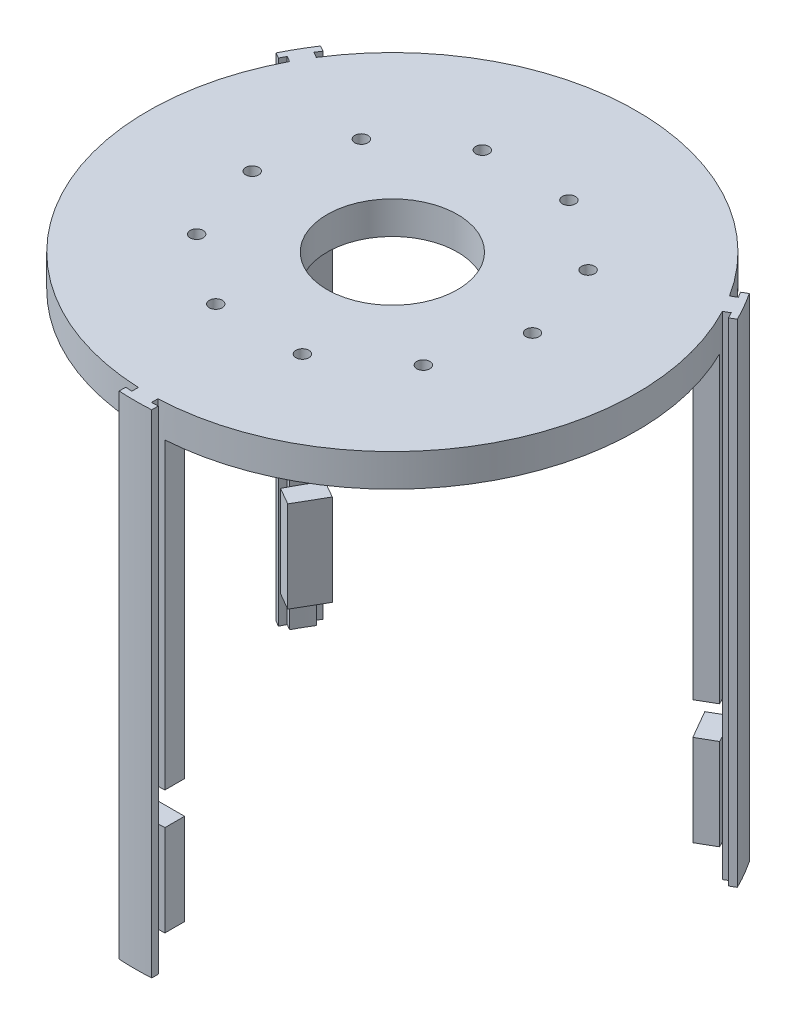
from build123d import *

# Parameters (mm, degrees)
SKETCH1_R           = 37.5
BOSS_EXTRUDE1_DEPTH = 5
CUT_EXTRUDE1_REACH  = 55.268
SKETCH2_R           = 1
BOSS_EXTRUDE2_DEPTH = 65.5
CUT_EXTRUDE2_DEPTH  = 1.6
BOSS_EXTRUDE3_DEPTH = 75.5
CUT_EXTRUDE3_REACH  = 95.095
SKETCH6_R           = 10
SKETCH7_W           = 37.5
SKETCH7_H           = 5


with BuildPart() as part:
    # Sketch1 → Boss-Extrude1 (new body)
    with BuildSketch(Plane(origin=(0, 0, 0), x_dir=(1, 0, 0), z_dir=(0, 1, 0))):
        Circle(SKETCH1_R)
    extrude(amount=-BOSS_EXTRUDE1_DEPTH)

    # Sketch2 → Cut-Extrude1 (cut, up to next)
    with BuildSketch(Plane(origin=(0, 0, 0), x_dir=(1, 0, 0), z_dir=(0, 1, 0)), mode=Mode.PRIVATE) as cut_extrude1_sk1:
        with Locations((-21.5, 0)):
            Circle(SKETCH2_R)
    cut_extrude1_tool1 = extrude(cut_extrude1_sk1.sketch, amount=-CUT_EXTRUDE1_REACH, mode=Mode.PRIVATE) & part.part
    # Sketch2 → Cut-Extrude1 (cut, up to next)
    with BuildSketch(Plane(origin=(0, 0, 0), x_dir=(1, 0, 0), z_dir=(0, 1, 0)), mode=Mode.PRIVATE) as cut_extrude1_sk2:
        with Locations((-17.393865379, 12.637382924)):
            Circle(SKETCH2_R)
    cut_extrude1_tool2 = extrude(cut_extrude1_sk2.sketch, amount=-CUT_EXTRUDE1_REACH, mode=Mode.PRIVATE) & part.part
    # Sketch2 → Cut-Extrude1 (cut, up to next)
    with BuildSketch(Plane(origin=(0, 0, 0), x_dir=(1, 0, 0), z_dir=(0, 1, 0)), mode=Mode.PRIVATE) as cut_extrude1_sk3:
        with Locations((-6.643865379, 20.4477151)):
            Circle(SKETCH2_R)
    cut_extrude1_tool3 = extrude(cut_extrude1_sk3.sketch, amount=-CUT_EXTRUDE1_REACH, mode=Mode.PRIVATE) & part.part
    # Sketch2 → Cut-Extrude1 (cut, up to next)
    with BuildSketch(Plane(origin=(0, 0, 0), x_dir=(1, 0, 0), z_dir=(0, 1, 0)), mode=Mode.PRIVATE) as cut_extrude1_sk4:
        with Locations((6.643865379, 20.4477151)):
            Circle(SKETCH2_R)
    cut_extrude1_tool4 = extrude(cut_extrude1_sk4.sketch, amount=-CUT_EXTRUDE1_REACH, mode=Mode.PRIVATE) & part.part
    # Sketch2 → Cut-Extrude1 (cut, up to next)
    with BuildSketch(Plane(origin=(0, 0, 0), x_dir=(1, 0, 0), z_dir=(0, 1, 0)), mode=Mode.PRIVATE) as cut_extrude1_sk5:
        with Locations((17.393865379, 12.637382924)):
            Circle(SKETCH2_R)
    cut_extrude1_tool5 = extrude(cut_extrude1_sk5.sketch, amount=-CUT_EXTRUDE1_REACH, mode=Mode.PRIVATE) & part.part
    # Sketch2 → Cut-Extrude1 (cut, up to next)
    with BuildSketch(Plane(origin=(0, 0, 0), x_dir=(1, 0, 0), z_dir=(0, 1, 0)), mode=Mode.PRIVATE) as cut_extrude1_sk6:
        with Locations((21.5, 0)):
            Circle(SKETCH2_R)
    cut_extrude1_tool6 = extrude(cut_extrude1_sk6.sketch, amount=-CUT_EXTRUDE1_REACH, mode=Mode.PRIVATE) & part.part
    # Sketch2 → Cut-Extrude1 (cut, up to next)
    with BuildSketch(Plane(origin=(0, 0, 0), x_dir=(1, 0, 0), z_dir=(0, 1, 0)), mode=Mode.PRIVATE) as cut_extrude1_sk7:
        with Locations((17.393865379, -12.637382924)):
            Circle(SKETCH2_R)
    cut_extrude1_tool7 = extrude(cut_extrude1_sk7.sketch, amount=-CUT_EXTRUDE1_REACH, mode=Mode.PRIVATE) & part.part
    # Sketch2 → Cut-Extrude1 (cut, up to next)
    with BuildSketch(Plane(origin=(0, 0, 0), x_dir=(1, 0, 0), z_dir=(0, 1, 0)), mode=Mode.PRIVATE) as cut_extrude1_sk8:
        with Locations((6.643865379, -20.4477151)):
            Circle(SKETCH2_R)
    cut_extrude1_tool8 = extrude(cut_extrude1_sk8.sketch, amount=-CUT_EXTRUDE1_REACH, mode=Mode.PRIVATE) & part.part
    # Sketch2 → Cut-Extrude1 (cut, up to next)
    with BuildSketch(Plane(origin=(0, 0, 0), x_dir=(1, 0, 0), z_dir=(0, 1, 0)), mode=Mode.PRIVATE) as cut_extrude1_sk9:
        with Locations((-6.643865379, -20.4477151)):
            Circle(SKETCH2_R)
    cut_extrude1_tool9 = extrude(cut_extrude1_sk9.sketch, amount=-CUT_EXTRUDE1_REACH, mode=Mode.PRIVATE) & part.part
    # Sketch2 → Cut-Extrude1 (cut, up to next)
    with BuildSketch(Plane(origin=(0, 0, 0), x_dir=(1, 0, 0), z_dir=(0, 1, 0)), mode=Mode.PRIVATE) as cut_extrude1_sk10:
        with Locations((-17.393865379, -12.637382924)):
            Circle(SKETCH2_R)
    cut_extrude1_tool10 = extrude(cut_extrude1_sk10.sketch, amount=-CUT_EXTRUDE1_REACH, mode=Mode.PRIVATE) & part.part
    add(cut_extrude1_tool1.solids().sort_by_distance((-21.5, 0, 0))[0], mode=Mode.SUBTRACT)
    add(cut_extrude1_tool2.solids().sort_by_distance((-17.393865, 0, -12.637383))[0], mode=Mode.SUBTRACT)
    add(cut_extrude1_tool3.solids().sort_by_distance((-6.643865, 0, -20.447715))[0], mode=Mode.SUBTRACT)
    add(cut_extrude1_tool4.solids().sort_by_distance((6.643865, 0, -20.447715))[0], mode=Mode.SUBTRACT)
    add(cut_extrude1_tool5.solids().sort_by_distance((17.393865, 0, -12.637383))[0], mode=Mode.SUBTRACT)
    add(cut_extrude1_tool6.solids().sort_by_distance((21.5, 0, 0))[0], mode=Mode.SUBTRACT)
    add(cut_extrude1_tool7.solids().sort_by_distance((17.393865, 0, 12.637383))[0], mode=Mode.SUBTRACT)
    add(cut_extrude1_tool8.solids().sort_by_distance((6.643865, 0, 20.447715))[0], mode=Mode.SUBTRACT)
    add(cut_extrude1_tool9.solids().sort_by_distance((-6.643865, 0, 20.447715))[0], mode=Mode.SUBTRACT)
    add(cut_extrude1_tool10.solids().sort_by_distance((-17.393865, 0, 12.637383))[0], mode=Mode.SUBTRACT)

    # Sketch3 → Boss-Extrude2 (add)
    with BuildSketch(Plane.XZ.offset(5)):
        with BuildLine():
            Line((-2.470466912, 37.418535423), (-2.470466912, 34.414588897))
            Line((-2.470466912, 34.414588897), (2.529533088, 34.414588897))
            Line((2.529533088, 34.414588897), (2.529533088, 37.414588897))
            ThreePointArc((2.529533088, 37.414588897), (0.029598937, 37.499988319), (-2.470466912, 37.418535423))
        make_face()
        with BuildLine():
            Line((33.640635705, -16.569780607), (31.039141702, -15.067807344))
            Line((31.039141702, -15.067807344), (28.539141702, -19.397934363))
            Line((28.539141702, -19.397934363), (31.137217913, -20.897934363))
            ThreePointArc((31.137217913, -20.897934363), (32.461143057, -18.77562759), (33.640635705, -16.569780607))
        make_face()
        with BuildLine():
            Line((-31.170168793, -20.848754817), (-28.56867479, -19.346781554))
            Line((-28.56867479, -19.346781554), (-31.06867479, -15.016654535))
            Line((-31.06867479, -15.016654535), (-33.666751001, -16.516654535))
            ThreePointArc((-33.666751001, -16.516654535), (-32.490741994, -18.724360728), (-31.170168793, -20.848754817))
        make_face()
    extrude(amount=BOSS_EXTRUDE2_DEPTH)

    # Sketch4 → Cut-Extrude2 (cut)
    with BuildSketch(Plane.XZ.offset(5)):
        Polygon((-15.525520661, 11.27995103), (-15.284122516, 13.576700966), (-17.152467233, 14.93413286), (-19.262210097, 13.994814819), (-19.503608243, 11.698064883), (-17.635263525, 10.340632988), align=None)
        Polygon((-19.190598923, 0), (-20.345299462, 2), (-22.654700538, 2), (-23.809401077, 0), (-22.654700538, -2), (-20.345299462, -2), align=None)
        Polygon((-5.9302212, 18.251344158), (-4.384930257, 19.967563618), (-5.098574436, 22.16393456), (-7.357509559, 22.644086043), (-8.902800501, 20.927866583), (-8.189156322, 18.73149564), align=None)
        Polygon((5.9302212, 18.251344158), (8.189156322, 18.73149564), (8.902800501, 20.927866583), (7.357509559, 22.644086043), (5.098574436, 22.16393456), (4.384930257, 19.967563618), align=None)
        Polygon((15.525520661, 11.27995103), (17.635263525, 10.340632988), (19.503608243, 11.698064883), (19.262210097, 13.994814819), (17.152467233, 14.93413286), (15.284122516, 13.576700966), align=None)
        Polygon((19.190598923, 0), (20.345299462, -2), (22.654700538, -2), (23.809401077, 0), (22.654700538, 2), (20.345299462, 2), align=None)
        Polygon((15.525520661, -11.27995103), (15.284122516, -13.576700966), (17.152467233, -14.93413286), (19.262210097, -13.994814819), (19.503608243, -11.698064883), (17.635263525, -10.340632988), align=None)
        Polygon((5.9302212, -18.251344158), (4.384930257, -19.967563618), (5.098574436, -22.16393456), (7.357509559, -22.644086043), (8.902800501, -20.927866583), (8.189156322, -18.73149564), align=None)
        Polygon((-5.9302212, -18.251344158), (-8.189156322, -18.73149564), (-8.902800501, -20.927866583), (-7.357509559, -22.644086043), (-5.098574436, -22.16393456), (-4.384930257, -19.967563618), align=None)
        Polygon((-15.525520661, -11.27995103), (-17.635263525, -10.340632988), (-19.503608243, -11.698064883), (-19.262210097, -13.994814819), (-17.152467233, -14.93413286), (-15.284122516, -13.576700966), align=None)
    extrude(amount=-CUT_EXTRUDE2_DEPTH, mode=Mode.SUBTRACT)

    # Sketch5 → Boss-Extrude3 (add)
    with BuildSketch(Plane(origin=(0, 0, 0), x_dir=(1, 0, 0), z_dir=(0, 1, 0))):
        with BuildLine():
            Line((-2.498164888, -38.416053141), (-2.498164888, -39.420923026))
            ThreePointArc((-2.498164888, -39.420923026), (0.001838798, -39.499999957), (2.501835112, -39.420690266))
            Line((2.501835112, -39.420690266), (2.501835112, -38.415814294))
            ThreePointArc((2.501835112, -38.415814294), (2.002004433, -38.445103004), (1.501835112, -38.467888661))
            Line((1.501835112, -38.467888661), (1.501835112, -37.469914482))
            ThreePointArc((1.501835112, -37.469914482), (0.001839069, -37.499999955), (-1.498159918, -37.470061607))
            Line((-1.498159918, -37.470061607), (-1.498159918, -38.46803197))
            ThreePointArc((-1.498159918, -38.46803197), (-1.998331414, -38.445294099), (-2.498164888, -38.416053141))
        make_face()
        with BuildLine():
            Line((-32.020195489, 21.371500827), (-32.890438337, 21.873935769))
            ThreePointArc((-32.890438337, 21.873935769), (-34.208922812, 19.748407533), (-35.390236761, 17.54369237))
            Line((-35.390236761, 17.54369237), (-34.519988641, 17.041254384))
            ThreePointArc((-34.519988641, 17.041254384), (-34.295438069, 17.488764805), (-34.065086367, 17.933316972))
            Line((-34.065086367, 17.933316972), (-33.200815375, 17.434329882))
            ThreePointArc((-33.200815375, 17.434329882), (-32.476872137, 18.748407297), (-31.700945275, 20.032475351))
            Line((-31.700945275, 20.032475351), (-32.565212961, 20.531460533))
            ThreePointArc((-32.565212961, 20.531460533), (-32.295435639, 20.953252819), (-32.020195489, 21.371500827))
        make_face()
        with BuildLine():
            Line((34.518360378, 17.044552315), (35.388603225, 17.546987257))
            ThreePointArc((35.388603225, 17.546987257), (34.207084013, 19.751592425), (32.888401649, 21.876997896))
            Line((32.888401649, 21.876997896), (32.018153529, 21.37455991))
            ThreePointArc((32.018153529, 21.37455991), (32.293433636, 20.9563382), (32.563251255, 20.53457169))
            Line((32.563251255, 20.53457169), (31.698980263, 20.0355846))
            ThreePointArc((31.698980263, 20.0355846), (32.475033068, 18.751592658), (33.199105192, 17.437586256))
            Line((33.199105192, 17.437586256), (34.063372878, 17.936571437))
            ThreePointArc((34.063372878, 17.936571437), (34.293767052, 17.49204128), (34.518360378, 17.044552315))
        make_face()
    extrude(amount=-BOSS_EXTRUDE3_DEPTH)

    # Sketch6 → Cut-Extrude3 (cut, up to next)
    with BuildSketch(Plane(origin=(0, 0, 0), x_dir=(1, 0, 0), z_dir=(0, 1, 0)), mode=Mode.PRIVATE) as cut_extrude3_sk1:
        Circle(SKETCH6_R)
    cut_extrude3_tool1 = extrude(cut_extrude3_sk1.sketch, amount=-CUT_EXTRUDE3_REACH, mode=Mode.PRIVATE) & part.part
    add(cut_extrude3_tool1.solids().sort_by_distance((0, 0, 0))[0], mode=Mode.SUBTRACT)

    # Sketch7 → Cut-Revolve1 (revolve, cut)
    with BuildSketch(Plane(origin=(0, 0, 0), x_dir=(0, 0, -1), z_dir=(1, 0, 0))):
        with Locations((-18.75, -54)):
            Rectangle(SKETCH7_W, SKETCH7_H)
    revolve(axis=Axis((0, -27.016689378, 0), (0, -1, 0)), mode=Mode.SUBTRACT)


solid = part.part
